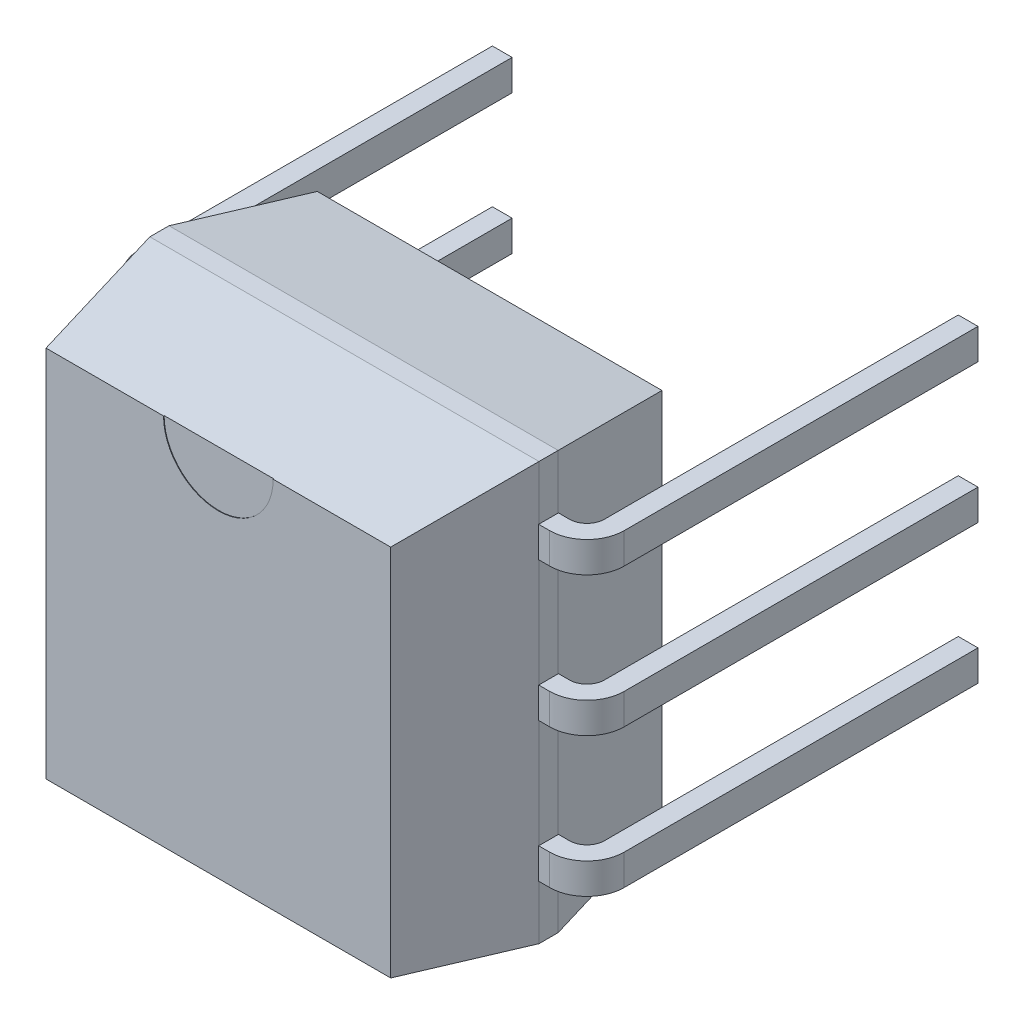
from build123d import *

# Parameters (mm, degrees)
EXTRUDE_1_DEPTH     = 4.95
SKETCH_5_W          = 0.36
SKETCH_5_H          = 0.56
SKETCH_5_2_W        = 0.36
SKETCH_5_2_H        = 0.56
EXTRUDE_2_DEPTH     = 4.1
CHAMFER_1_SIZE      = 2.3
CHAMFER_1_SIZE_2    = 0.405552056
SKETCH_6_R          = 1
CUT_EXTRUDE_1_DEPTH = 0.01
SKETCH_7_W          = 10.556189846
SKETCH_7_H          = 3.652287582
CUT_EXTRUDE_2_DEPTH = 20
CHAMFER_2_SIZE      = 2.3
CHAMFER_2_SIZE2     = 0.405552056


with BuildPart() as part:
    # Эскиз3 → Вытянуть1 (new body)
    with BuildSketch(Plane.XY.offset(5.33)):
        Polygon((0.7, 1.27), (4.25, 1.27), (7.8, 1.27), (7.8, -8.89), (0.7, -8.89), align=None)
    extrude(amount=-EXTRUDE_1_DEPTH)

    # По траектории1: sweep along a path in Эскиз4
    with BuildLine(Plane(origin=(0, 0, 0), x_dir=(1, 0, 0), z_dir=(0, 1, 0))) as sweep_1_path:
        Line((0, 0), (0, -2.355))
        ThreePointArc((0, -2.355), (0.146446609, -2.708553391), (0.5, -2.855))
        Line((0.5, -2.855), (0.7, -2.855))
        Line((0.7, -2.855), (7.8, -2.855))
        Line((7.8, -2.855), (8, -2.855))
        ThreePointArc((8, -2.855), (8.353553391, -2.708553391), (8.5, -2.355))
        Line((8.5, -2.355), (8.5, 0))
        Line((8.5, 0), (8.5, 4.1))
    # Эскиз5 → По траектории1 (sweep)
    with BuildSketch(Plane.XY):
        with Locations((0, -2.54)):
            Rectangle(SKETCH_5_W, SKETCH_5_H)
        Rectangle(SKETCH_5_W, SKETCH_5_H)
        with Locations((0, -5.08)):
            Rectangle(SKETCH_5_W, SKETCH_5_H)
        with Locations((0, -7.62)):
            Rectangle(SKETCH_5_W, SKETCH_5_H)
    sweep(path=sweep_1_path.line)

    # Эскиз5<2> → Вытянуть2 (add)
    with BuildSketch(Plane.XY):
        with Locations((0, -2.54)):
            Rectangle(SKETCH_5_2_W, SKETCH_5_2_H)
        Rectangle(SKETCH_5_2_W, SKETCH_5_2_H)
        with Locations((0, -5.08)):
            Rectangle(SKETCH_5_2_W, SKETCH_5_2_H)
        with Locations((0, -7.62)):
            Rectangle(SKETCH_5_2_W, SKETCH_5_2_H)
    extrude(amount=-EXTRUDE_2_DEPTH)

    # Фаска1
    # the kernel refuses this chamfer: 2.3, 0.405552056 mm, written as the material it takes off along each edge
    with BuildSketch(Plane(origin=(13.776639232, -8.89, 0.38), x_dir=(0, -0.006682531656101655, 0.9999776716360548), z_dir=(-1, 0, 0))) as chamfer_1_piece_1:
        Polygon((CHAMFER_1_SIZE * 0.999977671636, CHAMFER_1_SIZE * 0.0066825316561), (-CHAMFER_1_SIZE_2 * 0.00668253165, CHAMFER_1_SIZE_2 * 0.999977670722), (0, 0), align=None)
    extrude(amount=19.053278464, mode=Mode.SUBTRACT)
    with BuildSketch(Plane(origin=(13.776639232, -8.89, 5.33), x_dir=(4.402885138150507e-15, 0.9776715712462588, 0.2101387607674306), z_dir=(-1, 0, 0))) as chamfer_1_piece_2:
        Polygon((CHAMFER_1_SIZE_2 * 0.977671570353, CHAMFER_1_SIZE_2 * 0.210138760575), (-CHAMFER_1_SIZE * 0.210138760767, CHAMFER_1_SIZE * 0.977671571246), (0, 0), align=None)
    extrude(amount=19.053278464, mode=Mode.SUBTRACT)
    with BuildSketch(Plane(origin=(7.8, 7.246639232, 0.38), x_dir=(0.006682531656101655, 0, 0.9999776716360548), z_dir=(0, -1, 0))) as chamfer_1_piece_3_section:
        Polygon((CHAMFER_1_SIZE * 0.999977671636, CHAMFER_1_SIZE * 0.0066825316561), (-CHAMFER_1_SIZE_2 * 0.00668253165, CHAMFER_1_SIZE_2 * 0.999977670722), (0, 0), align=None)
    chamfer_1_piece_3 = extrude(amount=22.113278464, mode=Mode.PRIVATE)
    chamfer_1_piece_3 = split(chamfer_1_piece_3, bisect_by=Plane(origin=(7.799706122, 0.28, 2.676666667), z_dir=(0, 1, 0)), keep=Keep.TOP, mode=Mode.PRIVATE)
    add(chamfer_1_piece_3, mode=Mode.SUBTRACT)
    with BuildSketch(Plane(origin=(7.8, 7.246639232, 0.38), x_dir=(0.006682531656101655, 0, 0.9999776716360548), z_dir=(0, -1, 0))) as chamfer_1_piece_4_section:
        Polygon((CHAMFER_1_SIZE * 0.999977671636, CHAMFER_1_SIZE * 0.0066825316561), (-CHAMFER_1_SIZE_2 * 0.00668253165, CHAMFER_1_SIZE_2 * 0.999977670722), (0, 0), align=None)
    chamfer_1_piece_4 = extrude(amount=22.113278464, mode=Mode.PRIVATE)
    chamfer_1_piece_4 = split(chamfer_1_piece_4, bisect_by=Plane(origin=(7.664815344, 0, 2.675), z_dir=(0, 0, -1)), keep=Keep.TOP, mode=Mode.PRIVATE)
    add(chamfer_1_piece_4, mode=Mode.SUBTRACT)
    with BuildSketch(Plane(origin=(7.8, 7.246639232, 0.38), x_dir=(0.006682531656101655, 0, 0.9999776716360548), z_dir=(0, -1, 0))) as chamfer_1_piece_5_section:
        Polygon((CHAMFER_1_SIZE * 0.999977671636, CHAMFER_1_SIZE * 0.0066825316561), (-CHAMFER_1_SIZE_2 * 0.00668253165, CHAMFER_1_SIZE_2 * 0.999977670722), (0, 0), align=None)
    chamfer_1_piece_5 = extrude(amount=22.113278464, mode=Mode.PRIVATE)
    chamfer_1_piece_5 = split(chamfer_1_piece_5, bisect_by=Plane(origin=(7.799706122, -2.26, 2.676666667), z_dir=(0, 1, 0)), keep=Keep.TOP, mode=Mode.PRIVATE)
    chamfer_1_piece_5 = split(chamfer_1_piece_5, bisect_by=Plane(origin=(7.799706122, -0.28, 2.676666667), z_dir=(0, -1, 0)), keep=Keep.TOP, mode=Mode.PRIVATE)
    add(chamfer_1_piece_5, mode=Mode.SUBTRACT)
    with BuildSketch(Plane(origin=(7.8, 7.246639232, 0.38), x_dir=(0.006682531656101655, 0, 0.9999776716360548), z_dir=(0, -1, 0))) as chamfer_1_piece_6_section:
        Polygon((CHAMFER_1_SIZE * 0.999977671636, CHAMFER_1_SIZE * 0.0066825316561), (-CHAMFER_1_SIZE_2 * 0.00668253165, CHAMFER_1_SIZE_2 * 0.999977670722), (0, 0), align=None)
    chamfer_1_piece_6 = extrude(amount=22.113278464, mode=Mode.PRIVATE)
    chamfer_1_piece_6 = split(chamfer_1_piece_6, bisect_by=Plane(origin=(7.799706122, -2.82, 2.676666667), z_dir=(0, -1, 0)), keep=Keep.TOP, mode=Mode.PRIVATE)
    chamfer_1_piece_6 = split(chamfer_1_piece_6, bisect_by=Plane(origin=(7.799706122, -4.8, 2.676666667), z_dir=(0, 1, 0)), keep=Keep.TOP, mode=Mode.PRIVATE)
    add(chamfer_1_piece_6, mode=Mode.SUBTRACT)
    with BuildSketch(Plane(origin=(7.8, 7.246639232, 0.38), x_dir=(0.006682531656101655, 0, 0.9999776716360548), z_dir=(0, -1, 0))) as chamfer_1_piece_7_section:
        Polygon((CHAMFER_1_SIZE * 0.999977671636, CHAMFER_1_SIZE * 0.0066825316561), (-CHAMFER_1_SIZE_2 * 0.00668253165, CHAMFER_1_SIZE_2 * 0.999977670722), (0, 0), align=None)
    chamfer_1_piece_7 = extrude(amount=22.113278464, mode=Mode.PRIVATE)
    chamfer_1_piece_7 = split(chamfer_1_piece_7, bisect_by=Plane(origin=(7.799706122, -7.34, 2.676666667), z_dir=(0, 1, 0)), keep=Keep.TOP, mode=Mode.PRIVATE)
    chamfer_1_piece_7 = split(chamfer_1_piece_7, bisect_by=Plane(origin=(7.799706122, -5.36, 2.676666667), z_dir=(0, -1, 0)), keep=Keep.TOP, mode=Mode.PRIVATE)
    add(chamfer_1_piece_7, mode=Mode.SUBTRACT)
    with BuildSketch(Plane(origin=(7.8, 7.246639232, 0.38), x_dir=(0.006682531656101655, 0, 0.9999776716360548), z_dir=(0, -1, 0))) as chamfer_1_piece_8_section:
        Polygon((CHAMFER_1_SIZE * 0.999977671636, CHAMFER_1_SIZE * 0.0066825316561), (-CHAMFER_1_SIZE_2 * 0.00668253165, CHAMFER_1_SIZE_2 * 0.999977670722), (0, 0), align=None)
    chamfer_1_piece_8 = extrude(amount=22.113278464, mode=Mode.PRIVATE)
    chamfer_1_piece_8 = split(chamfer_1_piece_8, bisect_by=Plane(origin=(7.799706122, -7.9, 2.676666667), z_dir=(0, -1, 0)), keep=Keep.TOP, mode=Mode.PRIVATE)
    add(chamfer_1_piece_8, mode=Mode.SUBTRACT)
    with BuildSketch(Plane(origin=(7.8, 7.246639232, 5.33), x_dir=(-0.9776715712462587, -1.3674752616302956e-15, 0.21013876076743102), z_dir=(0, -1, 0))) as chamfer_1_piece_9_section:
        Polygon((CHAMFER_1_SIZE_2 * 0.977671570353, CHAMFER_1_SIZE_2 * 0.210138760575), (-CHAMFER_1_SIZE * 0.210138760767, CHAMFER_1_SIZE * 0.977671571246), (0, 0), align=None)
    chamfer_1_piece_9 = extrude(amount=22.113278464, mode=Mode.PRIVATE)
    chamfer_1_piece_9 = split(chamfer_1_piece_9, bisect_by=Plane(origin=(7.664815344, 0.775, 3.035), z_dir=(0, 0, 1)), keep=Keep.TOP, mode=Mode.PRIVATE)
    add(chamfer_1_piece_9, mode=Mode.SUBTRACT)
    with BuildSketch(Plane(origin=(7.8, 7.246639232, 5.33), x_dir=(-0.9776715712462587, -1.3674752616302956e-15, 0.21013876076743102), z_dir=(0, -1, 0))) as chamfer_1_piece_10_section:
        Polygon((CHAMFER_1_SIZE_2 * 0.977671570353, CHAMFER_1_SIZE_2 * 0.210138760575), (-CHAMFER_1_SIZE * 0.210138760767, CHAMFER_1_SIZE * 0.977671571246), (0, 0), align=None)
    chamfer_1_piece_10 = extrude(amount=22.113278464, mode=Mode.PRIVATE)
    chamfer_1_piece_10 = split(chamfer_1_piece_10, bisect_by=Plane(origin=(7.799706122, 0.28, 3.033333333), z_dir=(0, 1, 0)), keep=Keep.TOP, mode=Mode.PRIVATE)
    add(chamfer_1_piece_10, mode=Mode.SUBTRACT)
    with BuildSketch(Plane(origin=(7.8, 7.246639232, 5.33), x_dir=(-0.9776715712462587, -1.3674752616302956e-15, 0.21013876076743102), z_dir=(0, -1, 0))) as chamfer_1_piece_11_section:
        Polygon((CHAMFER_1_SIZE_2 * 0.977671570353, CHAMFER_1_SIZE_2 * 0.210138760575), (-CHAMFER_1_SIZE * 0.210138760767, CHAMFER_1_SIZE * 0.977671571246), (0, 0), align=None)
    chamfer_1_piece_11 = extrude(amount=22.113278464, mode=Mode.PRIVATE)
    chamfer_1_piece_11 = split(chamfer_1_piece_11, bisect_by=Plane(origin=(7.799706122, -2.26, 3.033333333), z_dir=(0, 1, 0)), keep=Keep.TOP, mode=Mode.PRIVATE)
    chamfer_1_piece_11 = split(chamfer_1_piece_11, bisect_by=Plane(origin=(7.799706122, -0.28, 3.033333333), z_dir=(0, -1, 0)), keep=Keep.TOP, mode=Mode.PRIVATE)
    add(chamfer_1_piece_11, mode=Mode.SUBTRACT)
    with BuildSketch(Plane(origin=(7.8, 7.246639232, 5.33), x_dir=(-0.9776715712462587, -1.3674752616302956e-15, 0.21013876076743102), z_dir=(0, -1, 0))) as chamfer_1_piece_12_section:
        Polygon((CHAMFER_1_SIZE_2 * 0.977671570353, CHAMFER_1_SIZE_2 * 0.210138760575), (-CHAMFER_1_SIZE * 0.210138760767, CHAMFER_1_SIZE * 0.977671571246), (0, 0), align=None)
    chamfer_1_piece_12 = extrude(amount=22.113278464, mode=Mode.PRIVATE)
    chamfer_1_piece_12 = split(chamfer_1_piece_12, bisect_by=Plane(origin=(7.799706122, -2.82, 3.033333333), z_dir=(0, -1, 0)), keep=Keep.TOP, mode=Mode.PRIVATE)
    chamfer_1_piece_12 = split(chamfer_1_piece_12, bisect_by=Plane(origin=(7.799706122, -4.8, 3.033333333), z_dir=(0, 1, 0)), keep=Keep.TOP, mode=Mode.PRIVATE)
    add(chamfer_1_piece_12, mode=Mode.SUBTRACT)
    with BuildSketch(Plane(origin=(7.8, 7.246639232, 5.33), x_dir=(-0.9776715712462587, -1.3674752616302956e-15, 0.21013876076743102), z_dir=(0, -1, 0))) as chamfer_1_piece_13_section:
        Polygon((CHAMFER_1_SIZE_2 * 0.977671570353, CHAMFER_1_SIZE_2 * 0.210138760575), (-CHAMFER_1_SIZE * 0.210138760767, CHAMFER_1_SIZE * 0.977671571246), (0, 0), align=None)
    chamfer_1_piece_13 = extrude(amount=22.113278464, mode=Mode.PRIVATE)
    chamfer_1_piece_13 = split(chamfer_1_piece_13, bisect_by=Plane(origin=(7.799706122, -7.34, 3.033333333), z_dir=(0, 1, 0)), keep=Keep.TOP, mode=Mode.PRIVATE)
    chamfer_1_piece_13 = split(chamfer_1_piece_13, bisect_by=Plane(origin=(7.799706122, -5.36, 3.033333333), z_dir=(0, -1, 0)), keep=Keep.TOP, mode=Mode.PRIVATE)
    add(chamfer_1_piece_13, mode=Mode.SUBTRACT)
    with BuildSketch(Plane(origin=(7.8, 7.246639232, 5.33), x_dir=(-0.9776715712462587, -1.3674752616302956e-15, 0.21013876076743102), z_dir=(0, -1, 0))) as chamfer_1_piece_14_section:
        Polygon((CHAMFER_1_SIZE_2 * 0.977671570353, CHAMFER_1_SIZE_2 * 0.210138760575), (-CHAMFER_1_SIZE * 0.210138760767, CHAMFER_1_SIZE * 0.977671571246), (0, 0), align=None)
    chamfer_1_piece_14 = extrude(amount=22.113278464, mode=Mode.PRIVATE)
    chamfer_1_piece_14 = split(chamfer_1_piece_14, bisect_by=Plane(origin=(7.799706122, -7.9, 3.033333333), z_dir=(0, -1, 0)), keep=Keep.TOP, mode=Mode.PRIVATE)
    add(chamfer_1_piece_14, mode=Mode.SUBTRACT)
    with BuildSketch(Plane(origin=(13.776639232, 1.27, 0.38), x_dir=(0, 0.006682531656101748, 0.9999776716360548), z_dir=(-1, 0, 0)), Plane(origin=(-5.276639232, 1.27, 5.33), x_dir=(0, 0.006682531656101748, -0.9999776716360548), z_dir=(1, 0, 0))) as chamfer_1_piece_15:
        Polygon((CHAMFER_1_SIZE * 0.999977671636, -CHAMFER_1_SIZE * 0.0066825316561), (-CHAMFER_1_SIZE_2 * 0.00668253165, -CHAMFER_1_SIZE_2 * 0.999977670722), (0, 0), align=None)
    extrude(amount=19.053278464, mode=Mode.SUBTRACT)
    with BuildSketch(Plane(origin=(0.7, -14.866639232, 0.38), x_dir=(0.9776715712462587, 0, -0.2101387607674313), z_dir=(0, 1, 0))) as chamfer_1_piece_16_section:
        Polygon((CHAMFER_1_SIZE_2 * 0.977671570353, -CHAMFER_1_SIZE_2 * 0.210138760575), (-CHAMFER_1_SIZE * 0.210138760767, -CHAMFER_1_SIZE * 0.977671571246), (0, 0), align=None)
    chamfer_1_piece_16 = extrude(amount=22.113278464, mode=Mode.PRIVATE)
    chamfer_1_piece_16 = split(chamfer_1_piece_16, bisect_by=Plane(origin=(0.835184656, -8.395, 2.675), z_dir=(0, 0, -1)), keep=Keep.TOP, mode=Mode.PRIVATE)
    add(chamfer_1_piece_16, mode=Mode.SUBTRACT)
    with BuildSketch(Plane(origin=(0.7, -14.866639232, 0.38), x_dir=(0.9776715712462587, 0, -0.2101387607674313), z_dir=(0, 1, 0))) as chamfer_1_piece_17_section:
        Polygon((CHAMFER_1_SIZE_2 * 0.977671570353, -CHAMFER_1_SIZE_2 * 0.210138760575), (-CHAMFER_1_SIZE * 0.210138760767, -CHAMFER_1_SIZE * 0.977671571246), (0, 0), align=None)
    chamfer_1_piece_17 = extrude(amount=22.113278464, mode=Mode.PRIVATE)
    chamfer_1_piece_17 = split(chamfer_1_piece_17, bisect_by=Plane(origin=(0.700293878, -7.9, 2.676666667), z_dir=(0, -1, 0)), keep=Keep.TOP, mode=Mode.PRIVATE)
    add(chamfer_1_piece_17, mode=Mode.SUBTRACT)
    with BuildSketch(Plane(origin=(0.7, -14.866639232, 0.38), x_dir=(0.9776715712462587, 0, -0.2101387607674313), z_dir=(0, 1, 0))) as chamfer_1_piece_18_section:
        Polygon((CHAMFER_1_SIZE_2 * 0.977671570353, -CHAMFER_1_SIZE_2 * 0.210138760575), (-CHAMFER_1_SIZE * 0.210138760767, -CHAMFER_1_SIZE * 0.977671571246), (0, 0), align=None)
    chamfer_1_piece_18 = extrude(amount=22.113278464, mode=Mode.PRIVATE)
    chamfer_1_piece_18 = split(chamfer_1_piece_18, bisect_by=Plane(origin=(0.700293878, -5.36, 2.676666667), z_dir=(0, -1, 0)), keep=Keep.TOP, mode=Mode.PRIVATE)
    chamfer_1_piece_18 = split(chamfer_1_piece_18, bisect_by=Plane(origin=(0.700293878, -7.34, 2.676666667), z_dir=(0, 1, 0)), keep=Keep.TOP, mode=Mode.PRIVATE)
    add(chamfer_1_piece_18, mode=Mode.SUBTRACT)
    with BuildSketch(Plane(origin=(0.7, -14.866639232, 0.38), x_dir=(0.9776715712462587, 0, -0.2101387607674313), z_dir=(0, 1, 0))) as chamfer_1_piece_19_section:
        Polygon((CHAMFER_1_SIZE_2 * 0.977671570353, -CHAMFER_1_SIZE_2 * 0.210138760575), (-CHAMFER_1_SIZE * 0.210138760767, -CHAMFER_1_SIZE * 0.977671571246), (0, 0), align=None)
    chamfer_1_piece_19 = extrude(amount=22.113278464, mode=Mode.PRIVATE)
    chamfer_1_piece_19 = split(chamfer_1_piece_19, bisect_by=Plane(origin=(0.700293878, -2.82, 2.676666667), z_dir=(0, -1, 0)), keep=Keep.TOP, mode=Mode.PRIVATE)
    chamfer_1_piece_19 = split(chamfer_1_piece_19, bisect_by=Plane(origin=(0.700293878, -4.8, 2.676666667), z_dir=(0, 1, 0)), keep=Keep.TOP, mode=Mode.PRIVATE)
    add(chamfer_1_piece_19, mode=Mode.SUBTRACT)
    with BuildSketch(Plane(origin=(0.7, -14.866639232, 0.38), x_dir=(0.9776715712462587, 0, -0.2101387607674313), z_dir=(0, 1, 0))) as chamfer_1_piece_20_section:
        Polygon((CHAMFER_1_SIZE_2 * 0.977671570353, -CHAMFER_1_SIZE_2 * 0.210138760575), (-CHAMFER_1_SIZE * 0.210138760767, -CHAMFER_1_SIZE * 0.977671571246), (0, 0), align=None)
    chamfer_1_piece_20 = extrude(amount=22.113278464, mode=Mode.PRIVATE)
    chamfer_1_piece_20 = split(chamfer_1_piece_20, bisect_by=Plane(origin=(0.700293878, -0.28, 2.676666667), z_dir=(0, -1, 0)), keep=Keep.TOP, mode=Mode.PRIVATE)
    chamfer_1_piece_20 = split(chamfer_1_piece_20, bisect_by=Plane(origin=(0.700293878, -2.26, 2.676666667), z_dir=(0, 1, 0)), keep=Keep.TOP, mode=Mode.PRIVATE)
    add(chamfer_1_piece_20, mode=Mode.SUBTRACT)
    with BuildSketch(Plane(origin=(0.7, -14.866639232, 0.38), x_dir=(0.9776715712462587, 0, -0.2101387607674313), z_dir=(0, 1, 0))) as chamfer_1_piece_21_section:
        Polygon((CHAMFER_1_SIZE_2 * 0.977671570353, -CHAMFER_1_SIZE_2 * 0.210138760575), (-CHAMFER_1_SIZE * 0.210138760767, -CHAMFER_1_SIZE * 0.977671571246), (0, 0), align=None)
    chamfer_1_piece_21 = extrude(amount=22.113278464, mode=Mode.PRIVATE)
    chamfer_1_piece_21 = split(chamfer_1_piece_21, bisect_by=Plane(origin=(0.700293878, 0.28, 2.676666667), z_dir=(0, 1, 0)), keep=Keep.TOP, mode=Mode.PRIVATE)
    add(chamfer_1_piece_21, mode=Mode.SUBTRACT)
    with BuildSketch(Plane(origin=(0.7, -14.866639232, 5.33), x_dir=(0.9776715712462587, 0, 0.2101387607674309), z_dir=(0, 1, 0))) as chamfer_1_piece_22_section:
        Polygon((CHAMFER_1_SIZE_2 * 0.977671570353, CHAMFER_1_SIZE_2 * 0.210138760575), (-CHAMFER_1_SIZE * 0.210138760767, CHAMFER_1_SIZE * 0.977671571246), (0, 0), align=None)
    chamfer_1_piece_22 = extrude(amount=22.113278464, mode=Mode.PRIVATE)
    chamfer_1_piece_22 = split(chamfer_1_piece_22, bisect_by=Plane(origin=(0.835184656, -8.395, 3.035), z_dir=(0, 0, 1)), keep=Keep.TOP, mode=Mode.PRIVATE)
    add(chamfer_1_piece_22, mode=Mode.SUBTRACT)
    with BuildSketch(Plane(origin=(0.7, -14.866639232, 5.33), x_dir=(0.9776715712462587, 0, 0.2101387607674309), z_dir=(0, 1, 0))) as chamfer_1_piece_23_section:
        Polygon((CHAMFER_1_SIZE_2 * 0.977671570353, CHAMFER_1_SIZE_2 * 0.210138760575), (-CHAMFER_1_SIZE * 0.210138760767, CHAMFER_1_SIZE * 0.977671571246), (0, 0), align=None)
    chamfer_1_piece_23 = extrude(amount=22.113278464, mode=Mode.PRIVATE)
    chamfer_1_piece_23 = split(chamfer_1_piece_23, bisect_by=Plane(origin=(0.700293878, -7.9, 3.033333333), z_dir=(0, -1, 0)), keep=Keep.TOP, mode=Mode.PRIVATE)
    add(chamfer_1_piece_23, mode=Mode.SUBTRACT)
    with BuildSketch(Plane(origin=(0.7, -14.866639232, 5.33), x_dir=(0.9776715712462587, 0, 0.2101387607674309), z_dir=(0, 1, 0))) as chamfer_1_piece_24_section:
        Polygon((CHAMFER_1_SIZE_2 * 0.977671570353, CHAMFER_1_SIZE_2 * 0.210138760575), (-CHAMFER_1_SIZE * 0.210138760767, CHAMFER_1_SIZE * 0.977671571246), (0, 0), align=None)
    chamfer_1_piece_24 = extrude(amount=22.113278464, mode=Mode.PRIVATE)
    chamfer_1_piece_24 = split(chamfer_1_piece_24, bisect_by=Plane(origin=(0.700293878, -5.36, 3.033333333), z_dir=(0, -1, 0)), keep=Keep.TOP, mode=Mode.PRIVATE)
    chamfer_1_piece_24 = split(chamfer_1_piece_24, bisect_by=Plane(origin=(0.700293878, -7.34, 3.033333333), z_dir=(0, 1, 0)), keep=Keep.TOP, mode=Mode.PRIVATE)
    add(chamfer_1_piece_24, mode=Mode.SUBTRACT)
    with BuildSketch(Plane(origin=(0.7, -14.866639232, 5.33), x_dir=(0.9776715712462587, 0, 0.2101387607674309), z_dir=(0, 1, 0))) as chamfer_1_piece_25_section:
        Polygon((CHAMFER_1_SIZE_2 * 0.977671570353, CHAMFER_1_SIZE_2 * 0.210138760575), (-CHAMFER_1_SIZE * 0.210138760767, CHAMFER_1_SIZE * 0.977671571246), (0, 0), align=None)
    chamfer_1_piece_25 = extrude(amount=22.113278464, mode=Mode.PRIVATE)
    chamfer_1_piece_25 = split(chamfer_1_piece_25, bisect_by=Plane(origin=(0.700293878, -2.82, 3.033333333), z_dir=(0, -1, 0)), keep=Keep.TOP, mode=Mode.PRIVATE)
    chamfer_1_piece_25 = split(chamfer_1_piece_25, bisect_by=Plane(origin=(0.700293878, -4.8, 3.033333333), z_dir=(0, 1, 0)), keep=Keep.TOP, mode=Mode.PRIVATE)
    add(chamfer_1_piece_25, mode=Mode.SUBTRACT)
    with BuildSketch(Plane(origin=(0.7, -14.866639232, 5.33), x_dir=(0.9776715712462587, 0, 0.2101387607674309), z_dir=(0, 1, 0))) as chamfer_1_piece_26_section:
        Polygon((CHAMFER_1_SIZE_2 * 0.977671570353, CHAMFER_1_SIZE_2 * 0.210138760575), (-CHAMFER_1_SIZE * 0.210138760767, CHAMFER_1_SIZE * 0.977671571246), (0, 0), align=None)
    chamfer_1_piece_26 = extrude(amount=22.113278464, mode=Mode.PRIVATE)
    chamfer_1_piece_26 = split(chamfer_1_piece_26, bisect_by=Plane(origin=(0.700293878, -0.28, 3.033333333), z_dir=(0, -1, 0)), keep=Keep.TOP, mode=Mode.PRIVATE)
    chamfer_1_piece_26 = split(chamfer_1_piece_26, bisect_by=Plane(origin=(0.700293878, -2.26, 3.033333333), z_dir=(0, 1, 0)), keep=Keep.TOP, mode=Mode.PRIVATE)
    add(chamfer_1_piece_26, mode=Mode.SUBTRACT)
    with BuildSketch(Plane(origin=(0.7, -14.866639232, 5.33), x_dir=(0.9776715712462587, 0, 0.2101387607674309), z_dir=(0, 1, 0))) as chamfer_1_piece_27_section:
        Polygon((CHAMFER_1_SIZE_2 * 0.977671570353, CHAMFER_1_SIZE_2 * 0.210138760575), (-CHAMFER_1_SIZE * 0.210138760767, CHAMFER_1_SIZE * 0.977671571246), (0, 0), align=None)
    chamfer_1_piece_27 = extrude(amount=22.113278464, mode=Mode.PRIVATE)
    chamfer_1_piece_27 = split(chamfer_1_piece_27, bisect_by=Plane(origin=(0.700293878, 0.28, 3.033333333), z_dir=(0, 1, 0)), keep=Keep.TOP, mode=Mode.PRIVATE)
    add(chamfer_1_piece_27, mode=Mode.SUBTRACT)

    # Эскиз6 → Вырез-Вытянуть1 (cut)
    with BuildSketch(Plane.XY.offset(5.33)):
        with Locations((4.25, 0.864447944)):
            Circle(SKETCH_6_R)
    extrude(amount=-CUT_EXTRUDE_1_DEPTH, mode=Mode.SUBTRACT)

    # Эскиз7 → Вырез-Вытянуть2 (cut)
    with BuildSketch(Plane.XY.offset(5.33)):
        with Locations((4.103600287, -8.176143791)):
            Rectangle(SKETCH_7_W, SKETCH_7_H)
    extrude(amount=-CUT_EXTRUDE_2_DEPTH, mode=Mode.SUBTRACT)

    # Фаска2
    chamfer_2_edges = [part.edges().sort_by_distance(p)[0] for p in [
        (4.25, -6.35, 0.38),
        (4.25, -6.35, 5.33),
    ]]
    chamfer_2_side = [part.faces().sort_by_distance(p)[0] for p in [
        (4.25, -6.35, 2.855),
    ]]
    chamfer(chamfer_2_edges, length=CHAMFER_2_SIZE, length2=CHAMFER_2_SIZE2, reference=chamfer_2_side[0])


solid = part.part
